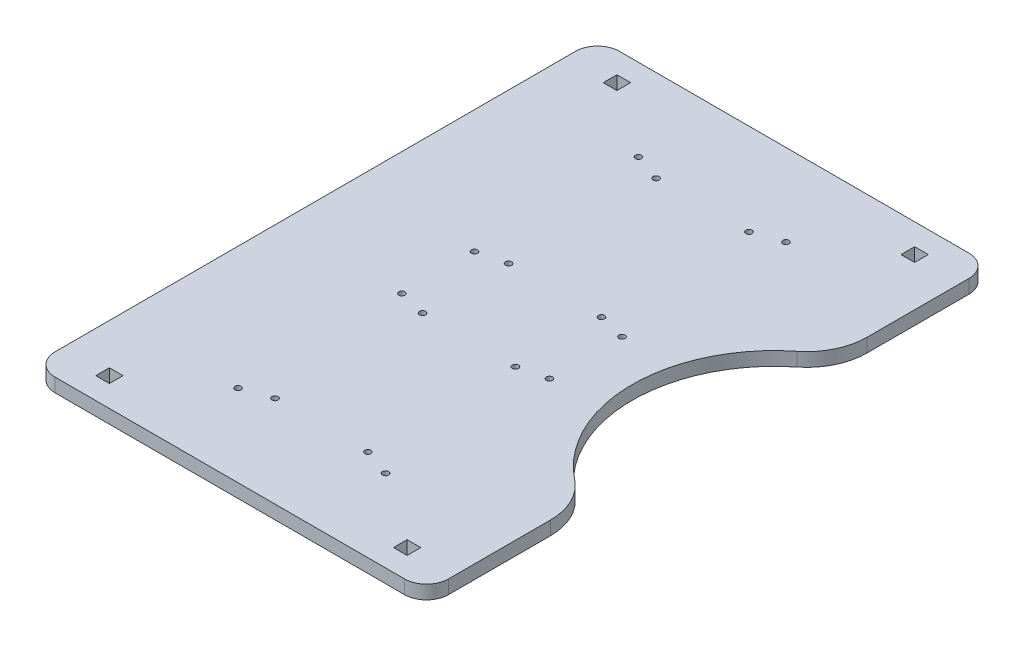
from build123d import *

# Parameters (mm, degrees)
SKETCH3_R           = 1.4224
SKETCH3_W           = 6.35
SKETCH3_H           = 6.35
BOSS_EXTRUDE1_DEPTH = 6.35
FILLET1_R           = 10.16
FILLET2_R           = 27.94


with BuildPart() as part:
    # Sketch3 → Boss-Extrude1 (new body)
    with BuildSketch(Plane(origin=(0, 0, 0), x_dir=(1, 0, 0), z_dir=(0, 1, 0))):
        with BuildLine():
            Line((182.88, 0), (0, 0))
            Line((0, 0), (0, 262.339276313))
            Line((0, 262.339276313), (182.88, 262.339276313))
            Line((182.88, 262.339276313), (182.88, 189.755056138))
            ThreePointArc((182.88, 189.755056138), (147.32, 131.169638157), (182.88, 72.584220176))
            Line((182.88, 72.584220176), (182.88, 0))
        make_face()
        with Locations((57.15, 38.1)):
            Circle(SKETCH3_R, mode=Mode.SUBTRACT)
        with Locations((57.15, 114.3)):
            Circle(SKETCH3_R, mode=Mode.SUBTRACT)
        with Locations((125.73, 114.3)):
            Circle(SKETCH3_R, mode=Mode.SUBTRACT)
        with Locations((125.73, 38.1)):
            Circle(SKETCH3_R, mode=Mode.SUBTRACT)
        with Locations((69.85, 151.157668748)):
            Circle(SKETCH3_R, mode=Mode.SUBTRACT)
        with Locations((69.85, 219.737668748)):
            Circle(SKETCH3_R, mode=Mode.SUBTRACT)
        with Locations((113.03, 151.157668748)):
            Circle(SKETCH3_R, mode=Mode.SUBTRACT)
        with Locations((113.03, 219.737668748)):
            Circle(SKETCH3_R, mode=Mode.SUBTRACT)
        with Locations((113.03, 42.601607565)):
            Circle(SKETCH3_R, mode=Mode.SUBTRACT)
        with Locations((113.03, 111.181607565)):
            Circle(SKETCH3_R, mode=Mode.SUBTRACT)
        with Locations((69.85, 111.181607565)):
            Circle(SKETCH3_R, mode=Mode.SUBTRACT)
        with Locations((69.85, 42.601607565)):
            Circle(SKETCH3_R, mode=Mode.SUBTRACT)
        with Locations((125.73, 148.039276313)):
            Circle(SKETCH3_R, mode=Mode.SUBTRACT)
        with Locations((125.73, 224.239276313)):
            Circle(SKETCH3_R, mode=Mode.SUBTRACT)
        with Locations((57.15, 224.239276313)):
            Circle(SKETCH3_R, mode=Mode.SUBTRACT)
        with Locations((57.15, 148.039276313)):
            Circle(SKETCH3_R, mode=Mode.SUBTRACT)
        with Locations((22.225, 13.212735966)):
            Rectangle(SKETCH3_W, SKETCH3_H, mode=Mode.SUBTRACT)
        with Locations((160.655, 13.212735966)):
            Rectangle(SKETCH3_W, SKETCH3_H, mode=Mode.SUBTRACT)
        with Locations((160.655, 249.126540348)):
            Rectangle(SKETCH3_W, SKETCH3_H, mode=Mode.SUBTRACT)
        with Locations((22.225, 249.126540348)):
            Rectangle(SKETCH3_W, SKETCH3_H, mode=Mode.SUBTRACT)
    extrude(amount=BOSS_EXTRUDE1_DEPTH)

    # Fillet1
    fillet1_edges = [part.edges().sort_by_distance(p)[0] for p in [
        (0, 3.175, 0),
        (0, 3.175, -262.339276313),
        (182.88, 3.175, -262.339276313),
        (182.88, 3.175, 0),
    ]]
    fillet(fillet1_edges, radius=FILLET1_R)

    # Fillet2
    fillet2_edges = [part.edges().sort_by_distance(p)[0] for p in [
        (182.88, 3.175, -189.755056138),
        (182.88, 3.175, -72.584220176),
    ]]
    fillet(fillet2_edges, radius=FILLET2_R)


solid = part.part
